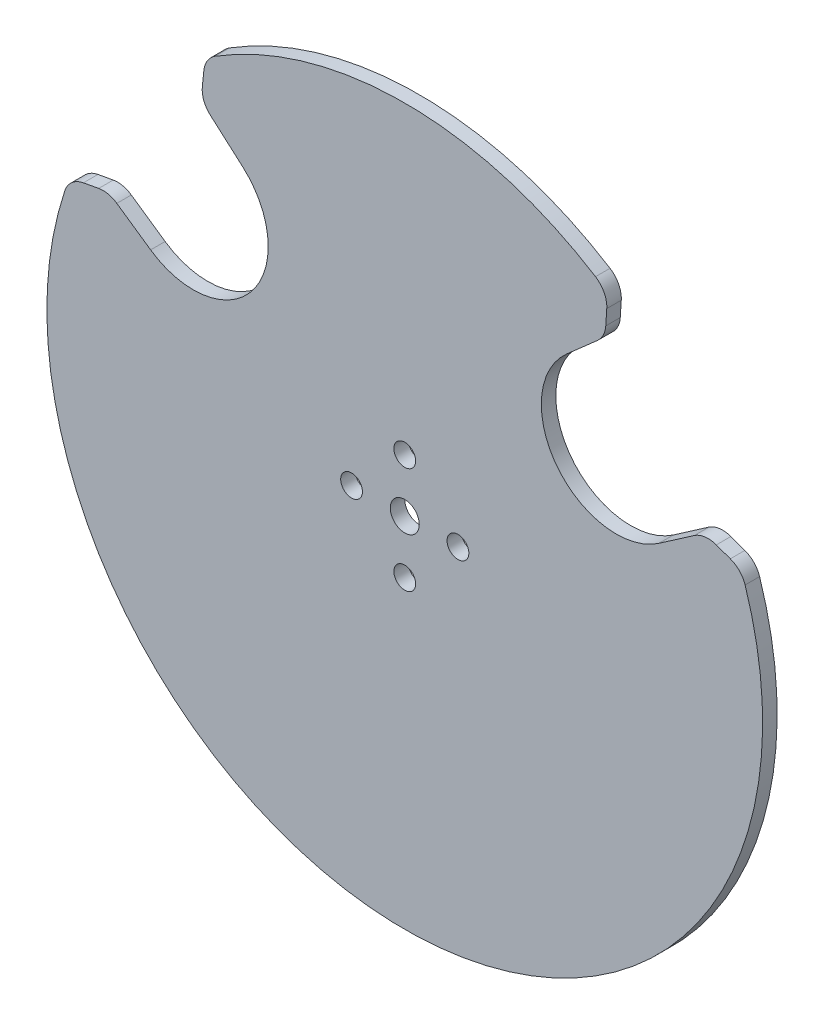
from build123d import *

# Parameters (mm, degrees)
ESQUISSE1_R        = 2.25
ESQUISSE1_R_2      = 3
BOSS_EXTRU_1_DEPTH = 3
CHANFREIN1_SIZE    = 7
CHANFREIN1_SIZE_2  = 6.077264162
CONG_2_R           = 5


with BuildPart() as part:
    # Esquisse1 → Boss.-Extru.1 (new body)
    with BuildSketch(Plane.XY):
        with BuildLine():
            Line((67.003163723, 31.409808199), (52.547583613, 21.418476063))
            ThreePointArc((52.547583613, 21.418476063), (31.520430144, 24.626459013), (33.494666824, 45.805097476))
            Line((33.494666824, 45.805097476), (46.686335037, 57.414163068))
            ThreePointArc((46.686335037, 57.414163068), (0, 74), (-46.686335037, 57.414163068))
            Line((-46.686335037, 57.414163068), (-33.494666824, 45.805097476))
            ThreePointArc((-33.494666824, 45.805097476), (-31.520430144, 24.626459013), (-52.547583613, 21.418476063))
            Line((-52.547583613, 21.418476063), (-67.003163723, 31.409808199))
            ThreePointArc((-67.003163723, 31.409808199), (0, -74), (67.003163723, 31.409808199))
        make_face()
        with Locations((0, 11)):
            Circle(ESQUISSE1_R, mode=Mode.SUBTRACT)
        with Locations((11, 0)):
            Circle(ESQUISSE1_R, mode=Mode.SUBTRACT)
        with Locations((0, -11)):
            Circle(ESQUISSE1_R, mode=Mode.SUBTRACT)
        with Locations((-11, 0)):
            Circle(ESQUISSE1_R, mode=Mode.SUBTRACT)
        Circle(ESQUISSE1_R_2, mode=Mode.SUBTRACT)
    extrude(amount=BOSS_EXTRU_1_DEPTH)

    # Chanfrein1
    # the kernel refuses this chamfer: 7, 6.077264162 mm, written as the material it takes off along each edge
    with BuildSketch(Plane(origin=(-67.003163723, 31.409808199, -18.001780916), x_dir=(0.8226281172410916, -0.5685797927506542, 0), z_dir=(0, 0, 1)), Plane(origin=(46.686335037, 57.414163068, -18.001780916), x_dir=(-0.7507022964494048, -0.660640645211593, 0), z_dir=(0, 0, 1))) as chanfrein1_piece_1:
        with BuildLine():
            Line((CHANFREIN1_SIZE, 0), (1.211839928, -5.788160072))
            ThreePointArc((1.211839928, -5.788160072), (0.563802351, -2.981105416), (0, 0))
            Line((0, 0), (CHANFREIN1_SIZE, 0))
        make_face()
    extrude(amount=39.003561832, mode=Mode.SUBTRACT)
    with BuildSketch(Plane(origin=(-46.686335037, 57.414163068, -17.23797929), x_dir=(0.8036456523944729, 0.5951081123522532, 0), z_dir=(0, 0, 1))) as chanfrein1_piece_2:
        with BuildLine():
            Line((6.703271947, 0), (CHANFREIN1_SIZE_2 * 0.210146029479, -CHANFREIN1_SIZE_2 * 0.977670008946))
            Line((CHANFREIN1_SIZE_2 * 0.210146029479, -CHANFREIN1_SIZE_2 * 0.977670008946), (0, 0))
            ThreePointArc((0, 0), (3.446010548, 0.075880568), (6.703271947, 0))
        make_face()
    extrude(amount=37.475958581, mode=Mode.SUBTRACT)
    with BuildSketch(Plane(origin=(67.003163723, 31.409808199, -17.23797929), x_dir=(-0.8226281172410943, -0.5685797927506503, 0), z_dir=(0, 0, 1))) as chanfrein1_piece_3:
        with BuildLine():
            Line((CHANFREIN1_SIZE_2, 0), (1.408665984, 6.553587944))
            ThreePointArc((1.408665984, 6.553587944), (0.649979278, 3.385007163), (0, 0))
            Line((0, 0), (CHANFREIN1_SIZE_2, 0))
        make_face()
    extrude(amount=37.475958581, mode=Mode.SUBTRACT)

    # Congé2
    cong_2_edges = [part.edges().sort_by_distance(p)[0] for p in [
        (62.003835348, 27.954398601, 1.5),
        (-69.297300979, 25.959277281, 1.5),
        (69.570593152, 25.217703474, 1.5),
        (-41.29927968, 61.403334583, 1.5),
        (41.952710216, 60.958757415, 1.5),
        (41.431418962, 52.789678551, 1.5),
        (-42.124118875, 53.39927535, 1.5),
        (-61.244766903, 27.429749649, 1.5),
    ]]
    fillet(cong_2_edges, radius=CONG_2_R)


solid = part.part
